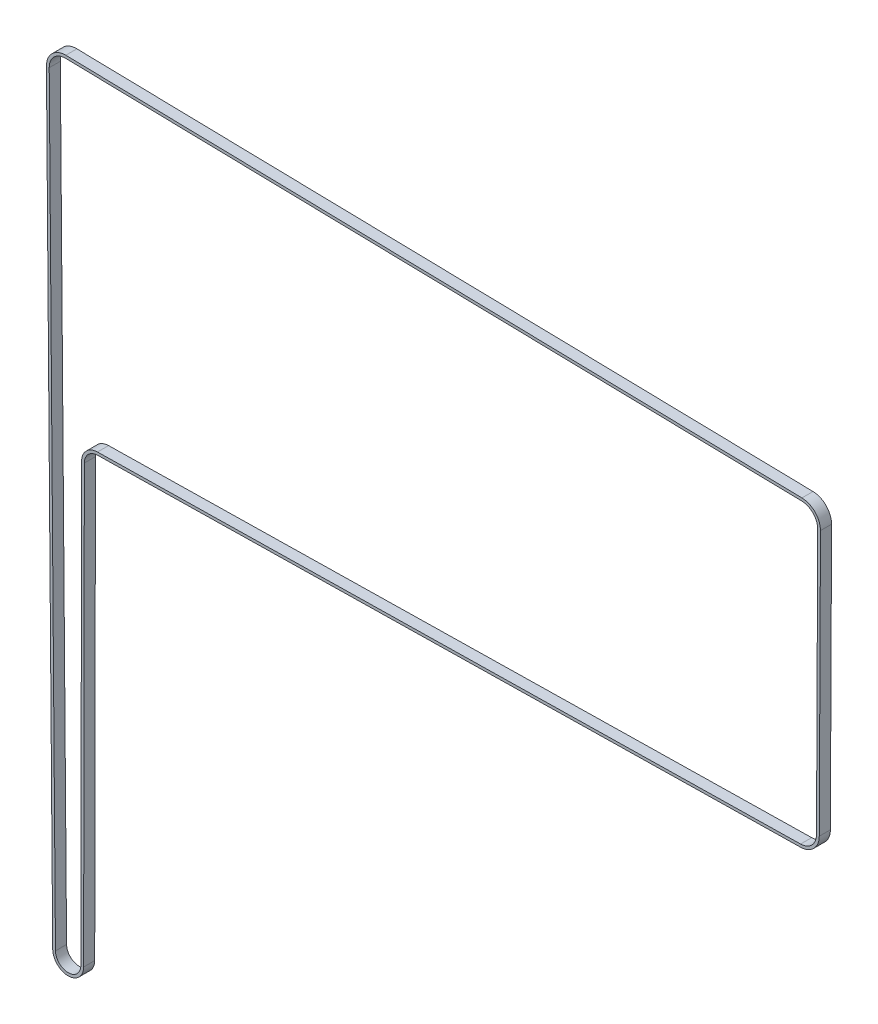
from build123d import *

# Parameters (mm, degrees)
EXTRUDE_1_DEPTH = 6


with BuildPart() as part:
    # Эскиз1 → Вытянуть-Тонкостенный1 (new body)
    with BuildSketch(Plane.XY):
        with BuildLine():
            Line((8.750009945, 236.236316306), (8.358688534, -0.013845213))
            ThreePointArc((8.358688534, -0.013845213), (0.027478742, -8.358654832), (-8.358416834, -0.068802026))
            Line((-8.358416834, -0.068802026), (-11.749652763, 411.915630333))
            ThreePointArc((-11.749652763, 411.915630333), (-8.702090663, 419.293311328), (-1.286638439, 422.247779121))
            Line((-1.286638439, 422.247779121), (396.860570527, 413.958245472))
            ThreePointArc((396.860570527, 413.958245472), (403.986255954, 410.865946025), (406.897104697, 403.664233154))
            Line((406.897104697, 403.664233154), (406.249895731, 260.178074325))
            ThreePointArc((406.249895731, 260.178074325), (403.293312437, 253.022217989), (396.175234336, 249.975805541))
            Line((396.175234336, 249.975805541), (15.876053762, 243.473247954))
            ThreePointArc((15.876053762, 243.473247954), (10.834051004, 241.311101307), (8.750009945, 236.236316306))
        make_face()
        with BuildLine():
            Line((7.250012003, 236.238800882), (6.858690591, -0.011360638))
            ThreePointArc((6.858690591, -0.011360638), (0.022547579, -6.858662938), (-6.858467649, -0.056455245))
            Line((-6.858467649, -0.056455245), (-10.249703578, 411.927977114))
            ThreePointArc((-10.249703578, 411.927977114), (-7.648126176, 418.225997476), (-1.317862082, 420.748104128))
            Line((-1.317862082, 420.748104128), (396.829346884, 412.458570479))
            ThreePointArc((396.829346884, 412.458570479), (402.912249078, 409.818802658), (405.397119956, 403.670998988))
            Line((405.397119956, 403.670998988), (404.749910989, 260.184840159))
            ThreePointArc((404.749910989, 260.184840159), (402.225998422, 254.076182312), (396.149590287, 251.475586319))
            Line((396.149590287, 251.475586319), (15.850409713, 244.973028732))
            ThreePointArc((15.850409713, 244.973028732), (9.76523397, 242.3635414), (7.250012003, 236.238800882))
        make_face(mode=Mode.SUBTRACT)
    extrude(amount=EXTRUDE_1_DEPTH)


solid = part.part
